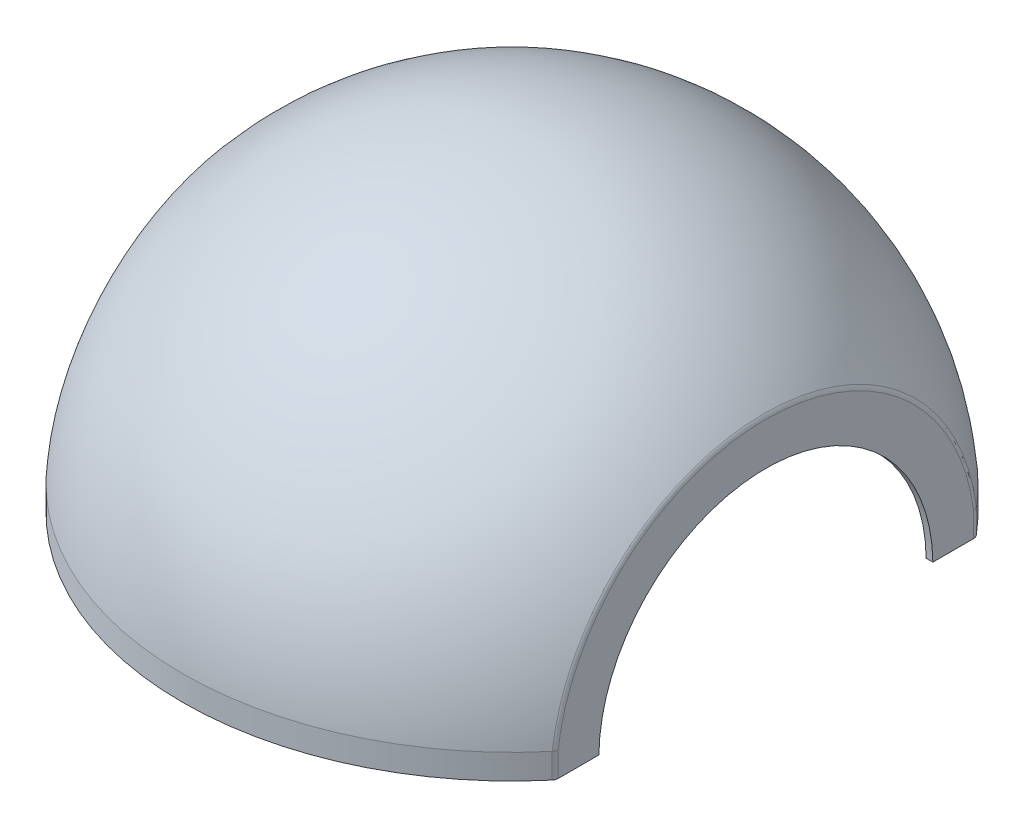
from build123d import *

# Parameters (mm, degrees)
ESQUISSE2_OUTSIDE_W     = 386.766
ESQUISSE2_OUTSIDE_H     = 238.266
ESQUISSE2_OUTSIDE_W_2   = 228
ESQUISSE2_OUTSIDE_H_2   = 155
ENL_V_MAT_EXTRU_1_DEPTH = 150
BOSS_EXTRU_1_DEPTH      = 3
BOSS_EXTRU_2_START      = -3
BOSS_EXTRU_2_DEPTH      = 3
CONG_1_R                = 3


with BuildPart() as part:
    # Esquisse1 → Révolution4 (revolve)
    with BuildSketch(Plane.XY, mode=Mode.PRIVATE) as r_volution4_sk:
        with BuildLine():
            Line((148, 12.175795662), (148, 1))
            Line((148, 1), (145, 1))
            Line((145, 1), (145, 12.051970793))
            ThreePointArc((145, 12.051970793), (98.530929788, 107.060290842), (0, 145.5))
            Line((0, 145.5), (0, 148.5))
            ThreePointArc((0, 148.5), (100.608509442, 109.225353412), (148, 12.175795662))
        make_face()
    revolve(r_volution4_sk.sketch.rotate(Axis((0, 0, 0), (0, 1, 0)), 90), axis=Axis((0, 0, 0), (0, 1, 0)))

    # Esquisse2 outside → Enlèv. mat.-Extru.1 (cut, symmetric)
    with BuildSketch(Plane.XY):
        with Locations((0, 74.75)):
            Rectangle(ESQUISSE2_OUTSIDE_W, ESQUISSE2_OUTSIDE_H)
        with Locations((0, 72.5)):
            Rectangle(ESQUISSE2_OUTSIDE_W_2, ESQUISSE2_OUTSIDE_H_2, mode=Mode.SUBTRACT)
    extrude(amount=ENL_V_MAT_EXTRU_1_DEPTH, both=True, mode=Mode.SUBTRACT)

    # Esquisse3 → Boss.-Extru.1 (add)
    with BuildSketch(Plane(origin=(114, 0, 0), x_dir=(0, 0, -1), z_dir=(1, 0, 0))):
        with BuildLine():
            Line((-93.994680701, 1), (-74.993333037, 1))
            ThreePointArc((-74.993333037, 1), (0, 75), (74.993333037, 1))
            Line((74.993333037, 1), (93.994680701, 1))
            ThreePointArc((93.994680701, 1), (0, 94), (-93.994680701, 1))
        make_face()
    extrude(amount=-BOSS_EXTRU_1_DEPTH)

    # Esquisse4 → Boss.-Extru.2 (add)
    with BuildSketch(Plane.ZY.offset(114).offset(BOSS_EXTRU_2_START)):
        with BuildLine():
            Line((-93.994680701, 1), (-74.993333037, 1))
            ThreePointArc((-74.993333037, 1), (0, 75), (74.993333037, 1))
            Line((74.993333037, 1), (93.994680701, 1))
            ThreePointArc((93.994680701, 1), (0, 94), (-93.994680701, 1))
        make_face()
    extrude(amount=BOSS_EXTRU_2_DEPTH)

    # Congé1
    # the kernel refuses this fillet: 3 mm, written as the material it takes off along each edge
    with BuildSketch(Plane(origin=(-114, 20.411983352, -94.382201712), x_dir=(0.6405708887604551, 0, -0.767899040546764), z_dir=(0, -1, 0)), Plane(origin=(114, 20.411983352, 94.382201712), x_dir=(-0.6405708887604538, 0, 0.7678990405467649), z_dir=(0, -1, 0))) as cong_1_piece_1:
        with BuildLine():
            CenterArc((1.087028375, 2.999979354), CONG_1_R, 230.165597581, 40.046969931)
            Line((-0.834684291, 0.696282232), (0, 0))
            ThreePointArc((0, 0), (0.549079179, -0.001018544), (1.098158359, 0))
        make_face()
    extrude(amount=22.157379249, mode=Mode.SUBTRACT)
    with BuildSketch(Plane(origin=(-114, 0, 0), x_dir=(0, 0.09906318090270165, -0.9950811455300712), z_dir=(0, -0.9950811455300712, -0.09906318090270165))) as cong_1_piece_2:
        with BuildLine():
            CenterArc((94.070452322, 3), CONG_1_R, 270, 40.28066089)
            ThreePointArc((96.010049277, 0.711340206), (95.587852119, 0.354883399), (95.164331553, 0))
            Line((95.164331553, 0), (94.070452322, 0))
        make_face()
    revolve(axis=Axis((-114, 0, 0), (1, 0, 0)), revolution_arc=168.629546335, mode=Mode.SUBTRACT)
    with BuildSketch(Plane(origin=(-114, 20.411983352, 94.382201712), x_dir=(0, 0, -1), z_dir=(0, -1, 0))) as cong_1_piece_3:
        with BuildLine():
            CenterArc((1.086971394, 3), CONG_1_R, 229.953030069, 40.046969931)
            ThreePointArc((-0.84327475, 0.703448276), (-0.422289825, 0.350941999), (0, 0))
            Line((0, 0), (1.086971394, 0))
        make_face()
    extrude(amount=22.157379249, mode=Mode.SUBTRACT)
    with BuildSketch(Plane(origin=(114, 0, 0), x_dir=(0, 0.09906318090270108, 0.9950811455300712), z_dir=(0, -0.9950811455300712, 0.09906318090270108))) as cong_1_piece_4:
        with BuildLine():
            CenterArc((94.070452322, 3), CONG_1_R, 270, 40.28066089)
            Line((94.070452322, 0), (95.164331553, 0))
            ThreePointArc((95.164331553, 0), (95.587852119, 0.354883399), (96.010049277, 0.711340206))
        make_face()
    revolve(axis=Axis((114, 0, 0), (-1, 0, 0)), revolution_arc=168.629546335, mode=Mode.SUBTRACT)
    with BuildSketch(Plane(origin=(114, 20.411983352, -94.382201712), x_dir=(-0.6405708887604424, 0, -0.7678990405467746), z_dir=(0, -1, 0))) as cong_1_piece_5:
        with BuildLine():
            CenterArc((1.087028375, -2.999979354), CONG_1_R, 89.787432488, 40.046969931)
            Line((-0.834684291, -0.696282232), (0, 0))
            ThreePointArc((0, 0), (0.549079179, 0.001018544), (1.098158359, 0))
        make_face()
    extrude(amount=22.157379249, mode=Mode.SUBTRACT)


solid = part.part
